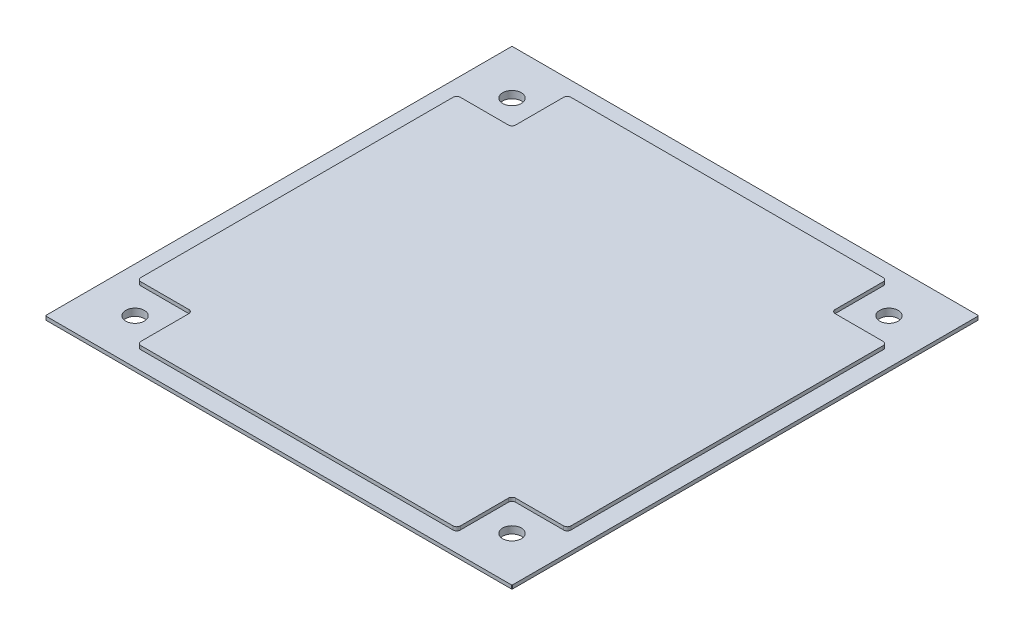
from build123d import *

# Parameters (mm, degrees)
SKETCH_1_W          = 130
SKETCH_1_H          = 130
EXTRUDE_1_DEPTH     = 3
SKETCH_2_R          = 2.6
CUT_EXTRUDE_1_DEPTH = 92.972822073
SKETCH_4_W          = 20.5
SKETCH_4_H          = 20.5
CUT_EXTRUDE_2_DEPTH = 1
SKETCH_5_W          = 89
SKETCH_5_H          = 5.1
SKETCH_5_W_2        = 5.1
SKETCH_5_H_2        = 89
CUT_EXTRUDE_3_DEPTH = 1
CHAMFER_1_SIZE      = 0.2
CHAMFER_2_SIZE      = 1
FILLET_2_R          = 1


with BuildPart() as part:
    # 草图1 → 凸台-拉伸1 (new body)
    with BuildSketch(Plane(origin=(0, 0, 0), x_dir=(1, 0, 0), z_dir=(0, 1, 0))):
        Rectangle(SKETCH_1_W, SKETCH_1_H)
    extrude(amount=EXTRUDE_1_DEPTH)

    # 草图2 → 切除-拉伸1 (cut, through all)
    with BuildSketch(Plane(origin=(0, 3, 0), x_dir=(1, 0, 0), z_dir=(0, 1, 0))):
        with Locations(Location((52.5, 52.5, 0), (0, 0, 270))):
            Circle(SKETCH_2_R)
        with Locations(Location((52.5, -52.5, 0), (0, 0, 270))):
            Circle(SKETCH_2_R)
        with Locations(Location((-52.5, -52.5, 0), (0, 0, 270))):
            Circle(SKETCH_2_R)
        with Locations(Location((-52.5, 52.5, 0), (0, 0, 270))):
            Circle(SKETCH_2_R)
    extrude(amount=-CUT_EXTRUDE_1_DEPTH, mode=Mode.SUBTRACT)

    # 草图4 → 切除-拉伸2 (cut)
    with BuildSketch(Plane(origin=(0, 3, 0), x_dir=(1, 0, 0), z_dir=(0, 1, 0))):
        with Locations((54.75, 54.75)):
            Rectangle(SKETCH_4_W, SKETCH_4_H)
        with Locations((54.75, -54.75)):
            Rectangle(SKETCH_4_W, SKETCH_4_H)
        with Locations((-54.75, -54.75)):
            Rectangle(SKETCH_4_W, SKETCH_4_H)
        with Locations((-54.75, 54.75)):
            Rectangle(SKETCH_4_W, SKETCH_4_H)
    extrude(amount=-CUT_EXTRUDE_2_DEPTH, mode=Mode.SUBTRACT)

    # 草图5 → 切除-拉伸3 (cut)
    with BuildSketch(Plane(origin=(0, 3, 0), x_dir=(1, 0, 0), z_dir=(0, 1, 0))):
        with Locations((0, 62.45)):
            Rectangle(SKETCH_5_W, SKETCH_5_H)
        with Locations((62.45, 0)):
            Rectangle(SKETCH_5_W_2, SKETCH_5_H_2)
        with Locations((0, -62.45)):
            Rectangle(SKETCH_5_W, SKETCH_5_H)
        with Locations((-62.45, 0)):
            Rectangle(SKETCH_5_W_2, SKETCH_5_H_2)
    extrude(amount=-CUT_EXTRUDE_3_DEPTH, mode=Mode.SUBTRACT)

    # 倒角1
    chamfer_1_edges = [part.edges().sort_by_distance(p)[0] for p in [
        (65, 1, 65),
        (-65, 1, 65),
        (-65, 1, -65),
        (65, 1, -65),
    ]]
    chamfer(chamfer_1_edges, length=CHAMFER_1_SIZE)

    # 倒角2
    # the kernel refuses this chamfer: 1 mm, written as the material it takes off along each edge
    with BuildSketch(Plane(origin=(67.371682988, 0, 65), x_dir=(0, -0.027495876610586292, -0.9996219169112968), z_dir=(-1, 0, 0)), Plane(origin=(65, 0, -67.371682988), x_dir=(-0.9996219169112968, -0.027495876610586292, 0), z_dir=(0, 0, 1)), Plane(origin=(-65, 0, 67.371682988), x_dir=(0.9996219169112968, -0.027495876610586292, 0), z_dir=(0, 0, -1))) as chamfer_2_piece_1:
        Polygon((CHAMFER_2_SIZE * 0.999621916911, -CHAMFER_2_SIZE * 0.0274958766106), (-CHAMFER_2_SIZE * 0.0274958766106, -CHAMFER_2_SIZE * 0.999621916911), (0, 0), align=None)
    extrude(amount=134.743365976, mode=Mode.SUBTRACT)
    with BuildSketch(Plane(origin=(-67.371682988, 0, -65), x_dir=(0, 0.999621916911297, -0.02749587661058218), z_dir=(1, 0, 0))) as chamfer_2_piece_2:
        Polygon((CHAMFER_2_SIZE * 0.999621916911, CHAMFER_2_SIZE * 0.0274958766106), (-CHAMFER_2_SIZE * 0.0274958766106, CHAMFER_2_SIZE * 0.999621916911), (0, 0), align=None)
    extrude(amount=134.743365976, mode=Mode.SUBTRACT)

    # 圆角2
    fillet_2_edges = [part.edges().sort_by_distance(p)[0] for p in [
        (-44.5, 2.5, -59.9),
        (44.5, 2.5, -59.9),
        (59.9, 2.5, -44.5),
        (59.9, 2.5, 44.5),
        (44.5, 2.5, 59.9),
        (-44.5, 2.5, 59.9),
        (-59.9, 2.5, 44.5),
        (-59.9, 2.5, -44.5),
        (-44.5, 2.5, -44.5),
        (-44.5, 2.5, 44.5),
        (44.5, 2.5, 44.5),
        (44.5, 2.5, -44.5),
    ]]
    fillet(fillet_2_edges, radius=FILLET_2_R)


solid = part.part
